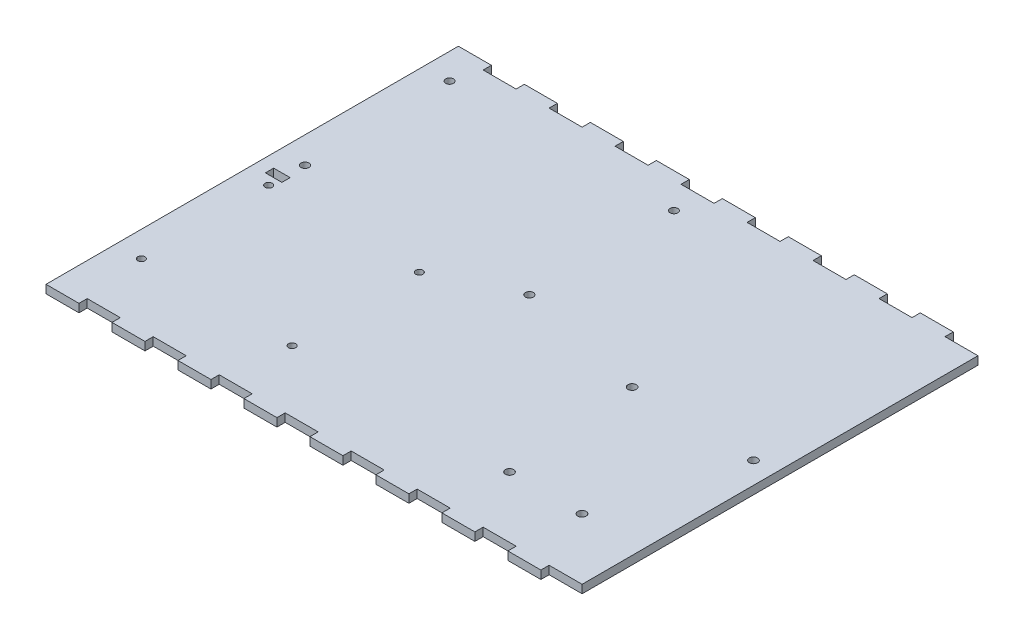
from build123d import *

# Parameters (mm, degrees)
SKETCH1_W               = 203.2
SKETCH1_H               = 152.4
BOSS_EXTRUDE1_DEPTH     = 3.175
SKETCH2_W               = 12.7
SKETCH2_H               = 3.175
BOSS_EXTRUDE2_DEPTH     = 3.175
BOSS_EXTRUDE2_2_DEPTH   = 3.175
BOSS_EXTRUDE2_3_DEPTH   = 3.175
BOSS_EXTRUDE2_4_DEPTH   = 3.175
BOSS_EXTRUDE2_5_DEPTH   = 3.175
BOSS_EXTRUDE2_6_DEPTH   = 3.175
BOSS_EXTRUDE2_7_DEPTH   = 3.175
BOSS_EXTRUDE2_8_DEPTH   = 3.175
BOSS_EXTRUDE2_9_DEPTH   = 3.175
BOSS_EXTRUDE2_10_DEPTH  = 3.175
BOSS_EXTRUDE2_11_DEPTH  = 3.175
BOSS_EXTRUDE2_12_DEPTH  = 3.175
BOSS_EXTRUDE2_13_DEPTH  = 3.175
BOSS_EXTRUDE2_14_DEPTH  = 3.175
BOSS_EXTRUDE2_15_DEPTH  = 3.175
BOSS_EXTRUDE2_16_DEPTH  = 3.175
SKETCH4_R               = 1.375
CUT_EXTRUDE1_DEPTH      = 294.475183832
SKETCH5_R               = 1.6
CUT_EXTRUDE2_DEPTH      = 317.962250237
CUT_EXTRUDE3_DEPTH      = 181.542007906
CUT_EXTRUDE3_DEPTH_BACK = 181.542007906
SKETCH10_R              = 1.535
SKETCH10_R_2            = 1.5
SKETCH11_W              = 6.35
SKETCH11_H              = 3.175
CUT_EXTRUDE4_DEPTH      = 256.93729945


with BuildPart() as part:
    # Sketch1 → Boss-Extrude1 (new body)
    with BuildSketch(Plane(origin=(0, 0, 0), x_dir=(1, 0, 0), z_dir=(0, 1, 0))):
        with Locations((101.6, 76.2)):
            Rectangle(SKETCH1_W, SKETCH1_H)
    extrude(amount=BOSS_EXTRUDE1_DEPTH)

    # Sketch4 → Cut-Extrude1 (cut, through all)
    with BuildSketch(Plane(origin=(-65.618517222, 3.175, -114.528898402), x_dir=(1, 0, 0), z_dir=(0, 1, 0))):
        with Locations((75.468517222, -41.828898402)):
            Circle(SKETCH4_R)
        with Locations((75.468517222, -90.828898402)):
            Circle(SKETCH4_R)
        with Locations((133.468517222, -90.828898402)):
            Circle(SKETCH4_R)
        with Locations((133.468517222, -41.828898402)):
            Circle(SKETCH4_R)
    extrude(amount=-CUT_EXTRUDE1_DEPTH, mode=Mode.SUBTRACT)

    # Sketch5 → Cut-Extrude2 (cut, through all)
    with BuildSketch(Plane(origin=(-58.332709996, 3.175, -175.865858612), x_dir=(0, 0, 1), z_dir=(0, 1, 0))):
        with Locations((100.475405858, 205.398928035)):
            Circle(SKETCH5_R)
        with Locations((101.575405858, 253.198928035)):
            Circle(SKETCH5_R)
        with Locations((152.375405858, 210.098928035)):
            Circle(SKETCH5_R)
        with Locations((152.375405858, 237.998928035)):
            Circle(SKETCH5_R)
    extrude(amount=-CUT_EXTRUDE2_DEPTH, mode=Mode.SUBTRACT)

    # Sketch10 → Cut-Extrude3 (cut, two sides: drawn at the far end of the back side and taken through both)
    with BuildSketch(Plane(origin=(154.738240667, 3.175, -89.784200023), x_dir=(0, 0, -1), z_dir=(0, 1, 0)).offset(-CUT_EXTRUDE3_DEPTH_BACK)):
        with Locations((-3.423776116, 144.568240667)):
            Circle(SKETCH10_R)
        with Locations((52.455799977, 144.785900219)):
            Circle(SKETCH10_R_2)
        with Locations((-3.423776116, 58.208240667)):
            Circle(SKETCH10_R)
        with Locations((52.455799977, 58.425900219)):
            Circle(SKETCH10_R_2)
    extrude(amount=CUT_EXTRUDE3_DEPTH + CUT_EXTRUDE3_DEPTH_BACK, mode=Mode.SUBTRACT)


with BuildPart() as body_2:
    # Sketch2 → Boss-Extrude2 (new body)
    with BuildSketch(Plane(origin=(0, 3.175, 0), x_dir=(1, 0, 0), z_dir=(0, 1, 0))):
        with Locations((31.75, -1.5875)):
            Rectangle(SKETCH2_W, SKETCH2_H)
    extrude(amount=-BOSS_EXTRUDE2_DEPTH)


with BuildPart() as body_3:
    # Sketch2 → Boss-Extrude2 2 (new body)
    with BuildSketch(Plane(origin=(0, 3.175, 0), x_dir=(1, 0, 0), z_dir=(0, 1, 0))):
        with Locations((6.35, -1.5875)):
            Rectangle(SKETCH2_W, SKETCH2_H)
    extrude(amount=-BOSS_EXTRUDE2_2_DEPTH)


with BuildPart() as body_4:
    # Sketch2 → Boss-Extrude2 3 (new body)
    with BuildSketch(Plane(origin=(0, 3.175, 0), x_dir=(1, 0, 0), z_dir=(0, 1, 0))):
        with Locations((57.15, -1.5875)):
            Rectangle(SKETCH2_W, SKETCH2_H)
    extrude(amount=-BOSS_EXTRUDE2_3_DEPTH)


with BuildPart() as body_5:
    # Sketch2 → Boss-Extrude2 4 (new body)
    with BuildSketch(Plane(origin=(0, 3.175, 0), x_dir=(1, 0, 0), z_dir=(0, 1, 0))):
        with Locations((82.55, -1.5875)):
            Rectangle(SKETCH2_W, SKETCH2_H)
    extrude(amount=-BOSS_EXTRUDE2_4_DEPTH)


with BuildPart() as body_6:
    # Sketch2 → Boss-Extrude2 5 (new body)
    with BuildSketch(Plane(origin=(0, 3.175, 0), x_dir=(1, 0, 0), z_dir=(0, 1, 0))):
        with Locations((107.95, -1.5875)):
            Rectangle(SKETCH2_W, SKETCH2_H)
    extrude(amount=-BOSS_EXTRUDE2_5_DEPTH)


with BuildPart() as body_7:
    # Sketch2 → Boss-Extrude2 6 (new body)
    with BuildSketch(Plane(origin=(0, 3.175, 0), x_dir=(1, 0, 0), z_dir=(0, 1, 0))):
        with Locations((133.35, -1.5875)):
            Rectangle(SKETCH2_W, SKETCH2_H)
    extrude(amount=-BOSS_EXTRUDE2_6_DEPTH)


with BuildPart() as body_8:
    # Sketch2 → Boss-Extrude2 7 (new body)
    with BuildSketch(Plane(origin=(0, 3.175, 0), x_dir=(1, 0, 0), z_dir=(0, 1, 0))):
        with Locations((158.75, -1.5875)):
            Rectangle(SKETCH2_W, SKETCH2_H)
    extrude(amount=-BOSS_EXTRUDE2_7_DEPTH)


with BuildPart() as body_9:
    # Sketch2 → Boss-Extrude2 8 (new body)
    with BuildSketch(Plane(origin=(0, 3.175, 0), x_dir=(1, 0, 0), z_dir=(0, 1, 0))):
        with Locations((184.15, -1.5875)):
            Rectangle(SKETCH2_W, SKETCH2_H)
    extrude(amount=-BOSS_EXTRUDE2_8_DEPTH)


with BuildPart() as body_10:
    # Sketch2 → Boss-Extrude2 9 (new body)
    with BuildSketch(Plane(origin=(0, 3.175, 0), x_dir=(1, 0, 0), z_dir=(0, 1, 0))):
        with Locations((184.15, 153.9875)):
            Rectangle(SKETCH2_W, SKETCH2_H)
    extrude(amount=-BOSS_EXTRUDE2_9_DEPTH)


with BuildPart() as body_11:
    # Sketch2 → Boss-Extrude2 10 (new body)
    with BuildSketch(Plane(origin=(0, 3.175, 0), x_dir=(1, 0, 0), z_dir=(0, 1, 0))):
        with Locations((158.75, 153.9875)):
            Rectangle(SKETCH2_W, SKETCH2_H)
    extrude(amount=-BOSS_EXTRUDE2_10_DEPTH)


with BuildPart() as body_12:
    # Sketch2 → Boss-Extrude2 11 (new body)
    with BuildSketch(Plane(origin=(0, 3.175, 0), x_dir=(1, 0, 0), z_dir=(0, 1, 0))):
        with Locations((133.35, 153.9875)):
            Rectangle(SKETCH2_W, SKETCH2_H)
    extrude(amount=-BOSS_EXTRUDE2_11_DEPTH)


with BuildPart() as body_13:
    # Sketch2 → Boss-Extrude2 12 (new body)
    with BuildSketch(Plane(origin=(0, 3.175, 0), x_dir=(1, 0, 0), z_dir=(0, 1, 0))):
        with Locations((107.95, 153.9875)):
            Rectangle(SKETCH2_W, SKETCH2_H)
    extrude(amount=-BOSS_EXTRUDE2_12_DEPTH)


with BuildPart() as body_14:
    # Sketch2 → Boss-Extrude2 13 (new body)
    with BuildSketch(Plane(origin=(0, 3.175, 0), x_dir=(1, 0, 0), z_dir=(0, 1, 0))):
        with Locations((82.55, 153.9875)):
            Rectangle(SKETCH2_W, SKETCH2_H)
    extrude(amount=-BOSS_EXTRUDE2_13_DEPTH)


with BuildPart() as body_15:
    # Sketch2 → Boss-Extrude2 14 (new body)
    with BuildSketch(Plane(origin=(0, 3.175, 0), x_dir=(1, 0, 0), z_dir=(0, 1, 0))):
        with Locations((57.15, 153.9875)):
            Rectangle(SKETCH2_W, SKETCH2_H)
    extrude(amount=-BOSS_EXTRUDE2_14_DEPTH)


with BuildPart() as body_16:
    # Sketch2 → Boss-Extrude2 15 (new body)
    with BuildSketch(Plane(origin=(0, 3.175, 0), x_dir=(1, 0, 0), z_dir=(0, 1, 0))):
        with Locations((31.75, 153.9875)):
            Rectangle(SKETCH2_W, SKETCH2_H)
    extrude(amount=-BOSS_EXTRUDE2_15_DEPTH)


with BuildPart() as body_17:
    # Sketch2 → Boss-Extrude2 16 (new body)
    with BuildSketch(Plane(origin=(0, 3.175, 0), x_dir=(1, 0, 0), z_dir=(0, 1, 0))):
        with Locations((6.35, 153.9875)):
            Rectangle(SKETCH2_W, SKETCH2_H)
    extrude(amount=-BOSS_EXTRUDE2_16_DEPTH)


with BuildPart() as body_3_1:
    add(body_3.part)

    # Combine1: union body 4, body 6, body 8, body 10, body 12, body 14, body 16, body 17, part, body 2, body 5, body 7, body 9, body 11, body 13, body 15
    add(body_4.part)
    add(body_6.part)
    add(body_8.part)
    add(body_10.part)
    add(body_12.part)
    add(body_14.part)
    add(body_16.part)
    add(body_17.part)
    add(part.part)
    add(body_2.part)
    add(body_5.part)
    add(body_7.part)
    add(body_9.part)
    add(body_11.part)
    add(body_13.part)
    add(body_15.part)

    # Sketch11 → Cut-Extrude4 (cut, through all)
    with BuildSketch(Plane(origin=(0, 3.175, 0), x_dir=(1, 0, 0), z_dir=(0, 1, 0))):
        with Locations((8.255, 77.7875)):
            Rectangle(SKETCH11_W, SKETCH11_H)
    extrude(amount=-CUT_EXTRUDE4_DEPTH, mode=Mode.SUBTRACT)


solid = body_3_1.part
